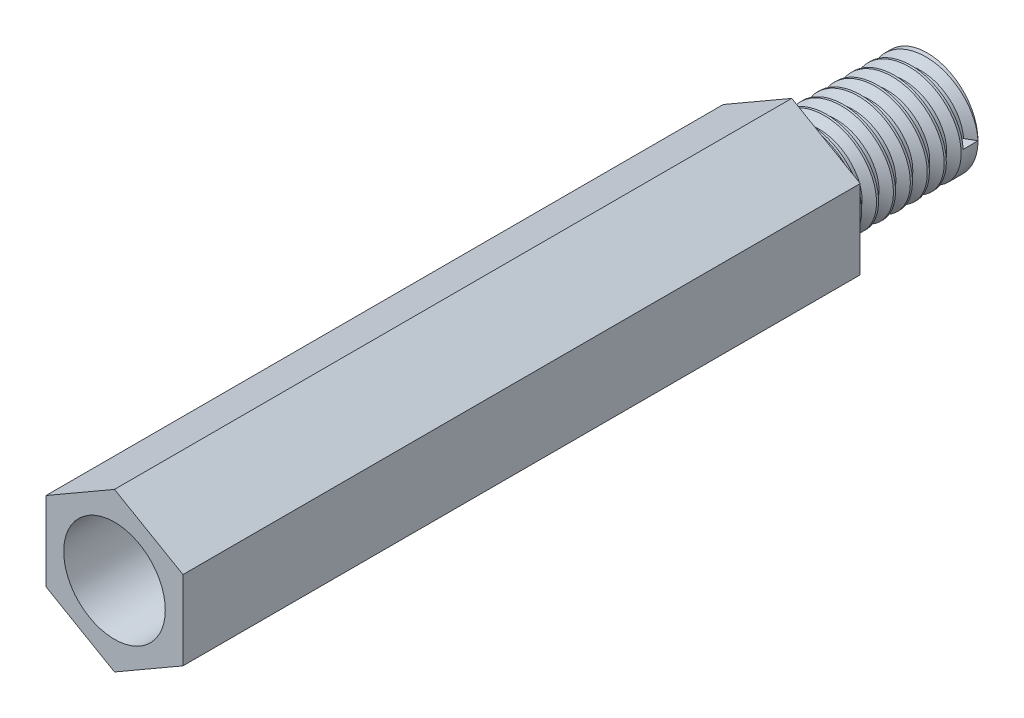
from build123d import *

# Parameters (mm, degrees)
SKETCH_1_R          = 2.335
SKETCH_1_R_2        = 1.5
EXTRUDE_1_DEPTH     = 20
SKETCH_3_OUTSIDE_W  = 10.882
SKETCH_3_OUTSIDE_H  = 10.882
CUT_EXTRUDE_2_DEPTH = 20
SKETCH_4_R          = 1.5
EXTRUDE_2_DEPTH     = 4
THREAD_1_PITCH      = 0.5


with BuildPart() as part:
    # Sketch 1 → 凸台-拉伸1 (new body)
    with BuildSketch(Plane.XY):
        Circle(SKETCH_1_R)
        Circle(SKETCH_1_R_2, mode=Mode.SUBTRACT)
    extrude(amount=EXTRUDE_1_DEPTH)

    # 草图3 outside → 切除-拉伸2 (cut)
    with BuildSketch(Plane.XY):
        Rectangle(SKETCH_3_OUTSIDE_W, SKETCH_3_OUTSIDE_H)
        Polygon((0, 2.335), (-2.022169318, 1.1675), (-2.022169318, -1.1675), (0, -2.335), (2.022169318, -1.1675), (2.022169318, 1.1675), align=None, mode=Mode.SUBTRACT)
    extrude(amount=CUT_EXTRUDE_2_DEPTH, mode=Mode.SUBTRACT)


with BuildPart() as body_2:
    # 草图4 → 凸台-拉伸2 (new body)
    with BuildSketch(Plane.XY):
        Circle(SKETCH_4_R)
    extrude(amount=-EXTRUDE_2_DEPTH)

    # 螺纹线1: the profile of Sketch 1 2 profile screwed along a right-hand helix of 8 turns, 6 arcs to a turn; built about Z, then put on its axis
    thread_1_z = Axis((0, 0, 0), (0, 0, 1))
    thread_1_corners = [(1.5003, 0, -0.000173205), (1.5003, 0, 0.437673204), (1.229367063, 0, 0.281249999), (1.229367063, 0, 0.156249999)]
    with BuildLine(mode=Mode.PRIVATE) as thread_1_profile:
        Line(thread_1_corners[0], thread_1_corners[1])
        Line(thread_1_corners[1], thread_1_corners[2])
        Line(thread_1_corners[2], thread_1_corners[3])
        Line(thread_1_corners[3], thread_1_corners[0])
    thread_1_cap = Face(thread_1_profile.wire())
    thread_1_turn_angles = [0, 30, 60, 90, 120, 150, 180, 210, 240, 270, 300, 330, 360]
    thread_1_turn_weights = [1, 0.8660254037844387, 1, 0.8660254037844387, 1, 0.8660254037844387, 1, 0.8660254037844387, 1, 0.8660254037844387, 1, 0.8660254037844387, 1]
    thread_1_turn_rails = [Edge.make_bspline([Vector(p[0], p[1], 0).rotate(thread_1_z, thread_1_turn_angles[k]) / thread_1_turn_weights[k] + Vector(0, 0, p[2] + THREAD_1_PITCH * thread_1_turn_angles[k] / 360) for k in range(13)], [0, 0, 0, 1, 1, 2, 2, 3, 3, 4, 4, 5, 5, 6, 6, 6], 2, thread_1_turn_weights) for p in thread_1_corners]
    thread_1_turn_sides = [Face.make_surface_from_curves(thread_1_turn_rails[p[0]], thread_1_turn_rails[p[1]]) for p in [(0, 1), (1, 2), (2, 3), (3, 0)]]
    thread_1 = Plane(origin=(0, 0, -4), x_dir=(1, 0, 0), z_dir=(0, 0, 1)) * Solid(Shell([*[p.moved(Location((0, 0, THREAD_1_PITCH * i))) for i in range(8) for p in thread_1_turn_sides], thread_1_cap, thread_1_cap.rotate(thread_1_z, 2880).moved(Location((0, 0, THREAD_1_PITCH * 2880 / 360)))]))
    add(thread_1, mode=Mode.SUBTRACT)


solid = Compound([part.part, body_2.part])
